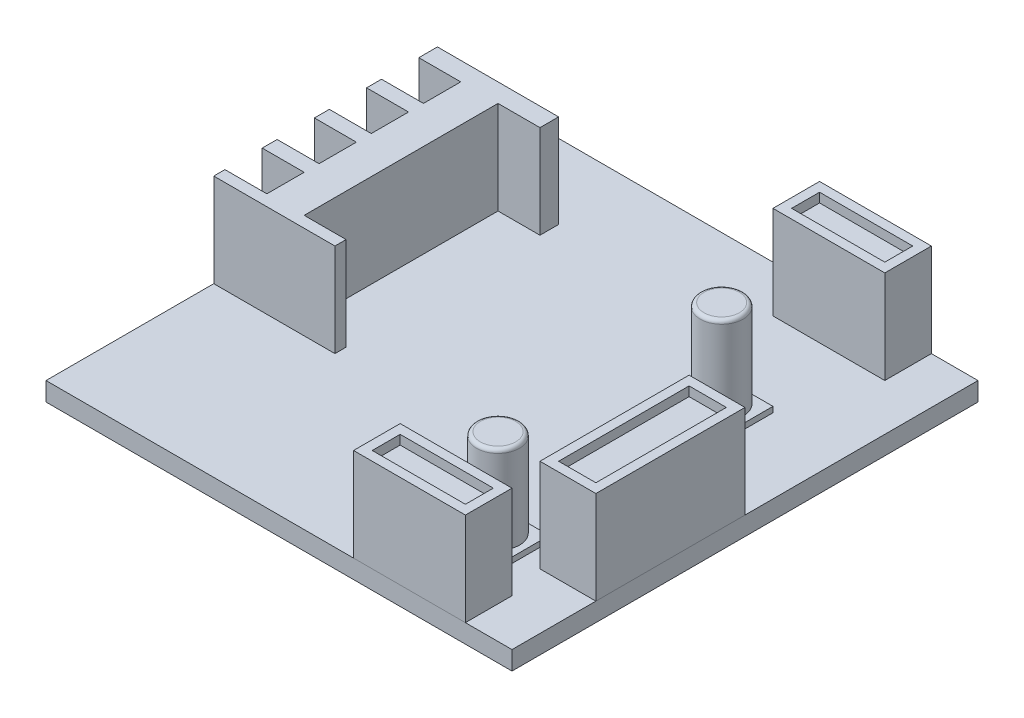
from build123d import *

# Parameters (mm, degrees)
SKETCH1_W             = 25
SKETCH1_H             = 25
BOSS_EXTRUDE1_DEPTH   = 1
SKETCH2_W             = 3
SKETCH2_H             = 2.5
SKETCH2_H_2           = 2.75
BOSS_EXTRUDE2_DEPTH   = 5
SKETCH3_W             = 2
SKETCH3_H             = 7
CUT_EXTRUDE1_DEPTH    = 0.5
SKETCH4_W             = 6
SKETCH4_H             = 2.5
BOSS_EXTRUDE3_DEPTH   = 5
BOSS_EXTRUDE3_2_DEPTH = 5
SKETCH5_W             = 5
SKETCH5_H             = 1.5
CUT_EXTRUDE2_DEPTH    = 0.5
SKETCH6_W             = 6.5
SKETCH6_H             = 12
BOSS_EXTRUDE4_DEPTH   = 5
SKETCH7_W             = 2.25
SKETCH7_H             = 2
CUT_EXTRUDE3_DEPTH    = 5
SKETCH8_W             = 2.25
SKETCH8_H             = 10.4
CUT_EXTRUDE4_DEPTH    = 5
SKETCH9_W             = 3
SKETCH9_H             = 2.5
BOSS_EXTRUDE5_DEPTH   = 0.3
SKETCH10_R            = 1.15
BOSS_EXTRUDE6_DEPTH   = 4.7
FILLET1_R             = 0.2
LPATTERN1_START       = 1.3
LPATTERN1_OUTLINE_R   = 1.15
LPATTERN1_DEPTH       = 4.7
LPATTERN1_START_2     = -5.5
LPATTERN1_2_OUTLINE_W = 3
LPATTERN1_2_OUTLINE_H = 0.3
LPATTERN1_2_DEPTH     = 2.5
FILLET2_R             = 0.2


# Read off the part's stored shape, not the designer's step: LPattern1
with BuildPart() as part:
    # Sketch1 → Boss-Extrude1 (new body)
    with BuildSketch(Plane(origin=(0, 0, 0), x_dir=(1, 0, 0), z_dir=(0, 1, 0))):
        Rectangle(SKETCH1_W, SKETCH1_H)
    extrude(amount=BOSS_EXTRUDE1_DEPTH)

    # Sketch6 → Boss-Extrude4 (add)
    with BuildSketch(Plane(origin=(0, 1, 0), x_dir=(1, 0, 0), z_dir=(0, 1, 0))):
        with Locations((-9.25, 2.5)):
            Rectangle(SKETCH6_W, SKETCH6_H)
    extrude(amount=BOSS_EXTRUDE4_DEPTH)

    # Sketch7 → Cut-Extrude3 (cut)
    with BuildSketch(Plane(origin=(0, 6, 0), x_dir=(1, 0, 0), z_dir=(0, 1, 0))):
        with Locations((-11.375, 6.5)):
            Rectangle(SKETCH7_W, SKETCH7_H)
        with Locations((-11.375, 3.7)):
            Rectangle(SKETCH7_W, SKETCH7_H)
        with Locations((-11.375, 0.9)):
            Rectangle(SKETCH7_W, SKETCH7_H)
        with Locations((-11.375, -1.9)):
            Rectangle(SKETCH7_W, SKETCH7_H)
    extrude(amount=-CUT_EXTRUDE3_DEPTH, mode=Mode.SUBTRACT)

    # Sketch8 → Cut-Extrude4 (cut)
    with BuildSketch(Plane(origin=(0, 6, 0), x_dir=(1, 0, 0), z_dir=(0, 1, 0))):
        with Locations((-7.125, 2.3)):
            Rectangle(SKETCH8_W, SKETCH8_H)
    extrude(amount=-CUT_EXTRUDE4_DEPTH, mode=Mode.SUBTRACT)

    # Sketch9 → Boss-Extrude5 (add)
    with BuildSketch(Plane(origin=(0, 1, 0), x_dir=(1, 0, 0), z_dir=(0, 1, 0))):
        with Locations((7, -7.75)):
            Rectangle(SKETCH9_W, SKETCH9_H)
    extrude(amount=BOSS_EXTRUDE5_DEPTH)

    # LPattern1 2 outline → LPattern1 2 (add)
    with BuildSketch(Plane.XY.offset(LPATTERN1_START_2)):
        with Locations((7, 1.15)):
            Rectangle(LPATTERN1_2_OUTLINE_W, LPATTERN1_2_OUTLINE_H)
    extrude(amount=LPATTERN1_2_DEPTH)


with BuildPart() as body_2:
    # Sketch2 → Boss-Extrude2 (new body)
    with BuildSketch(Plane(origin=(0, 1, 0), x_dir=(1, 0, 0), z_dir=(0, 1, 0))):
        with Locations((11, -6.75)):
            Rectangle(SKETCH2_W, SKETCH2_H)
        with Locations((11, -4.125)):
            Rectangle(SKETCH2_W, SKETCH2_H_2)
        with Locations((11, -1.375)):
            Rectangle(SKETCH2_W, SKETCH2_H_2)
    extrude(amount=BOSS_EXTRUDE2_DEPTH)

    # Sketch3 → Cut-Extrude1 (cut)
    with BuildSketch(Plane(origin=(0, 6, 0), x_dir=(1, 0, 0), z_dir=(0, 1, 0))):
        with Locations((11, -4)):
            Rectangle(SKETCH3_W, SKETCH3_H)
    extrude(amount=-CUT_EXTRUDE1_DEPTH, mode=Mode.SUBTRACT)


with BuildPart() as body_3:
    # Sketch4 → Boss-Extrude3 (new body)
    with BuildSketch(Plane(origin=(0, 1, 0), x_dir=(1, 0, 0), z_dir=(0, 1, 0))):
        with Locations((7, -11.25)):
            Rectangle(SKETCH4_W, SKETCH4_H)
    extrude(amount=BOSS_EXTRUDE3_DEPTH)


with BuildPart() as body_4:
    # Sketch4 → Boss-Extrude3 2 (new body)
    with BuildSketch(Plane(origin=(0, 1, 0), x_dir=(1, 0, 0), z_dir=(0, 1, 0))):
        with Locations((7, 11.25)):
            Rectangle(SKETCH4_W, SKETCH4_H)
    extrude(amount=BOSS_EXTRUDE3_2_DEPTH)


with BuildPart() as cut_extrude2_tool:
    # Sketch5 → Cut-Extrude2 (new body)
    with BuildSketch(Plane(origin=(0, 6, 0), x_dir=(1, 0, 0), z_dir=(0, 1, 0))):
        with Locations((7, -11.25)):
            Rectangle(SKETCH5_W, SKETCH5_H)
        with Locations((7, 11.25)):
            Rectangle(SKETCH5_W, SKETCH5_H)
    extrude(amount=-CUT_EXTRUDE2_DEPTH)


with BuildPart() as body_3_1:
    add(body_3.part)

    # Cut-Extrude2: cut by cut_extrude2_tool
    add(cut_extrude2_tool.part, mode=Mode.SUBTRACT)


with BuildPart() as body_4_1:
    add(body_4.part)

    # Cut-Extrude2: cut by cut_extrude2_tool
    add(cut_extrude2_tool.part, mode=Mode.SUBTRACT)


with BuildPart() as body_5:
    # Sketch10 → Boss-Extrude6 (new body)
    with BuildSketch(Plane(origin=(0, 1.3, 0), x_dir=(1, 0, 0), z_dir=(0, 1, 0))):
        with Locations(Location((7, -7.75, 0), (0, 0, 270))):
            Circle(SKETCH10_R)
    extrude(amount=BOSS_EXTRUDE6_DEPTH)

    # Fillet1
    fillet1_edges = [body_5.edges().sort_by_distance(p)[0] for p in [
        (7, 6, 6.6),
    ]]
    fillet(fillet1_edges, radius=FILLET1_R)


with BuildPart() as body_6:
    # LPattern1 outline → LPattern1 (new body)
    with BuildSketch(Plane(origin=(0, 0, 0), x_dir=(1, 0, 0), z_dir=(0, 1, 0)).offset(LPATTERN1_START)):
        with Locations((7, 4.25)):
            Circle(LPATTERN1_OUTLINE_R)
    extrude(amount=LPATTERN1_DEPTH)

    # Fillet2
    fillet2_edges = [body_6.edges().sort_by_distance(p)[0] for p in [
        (5.85, 6, -4.25),
    ]]
    fillet(fillet2_edges, radius=FILLET2_R)


solid = Compound([part.part, body_2.part, body_3_1.part, body_4_1.part, body_5.part, body_6.part])
